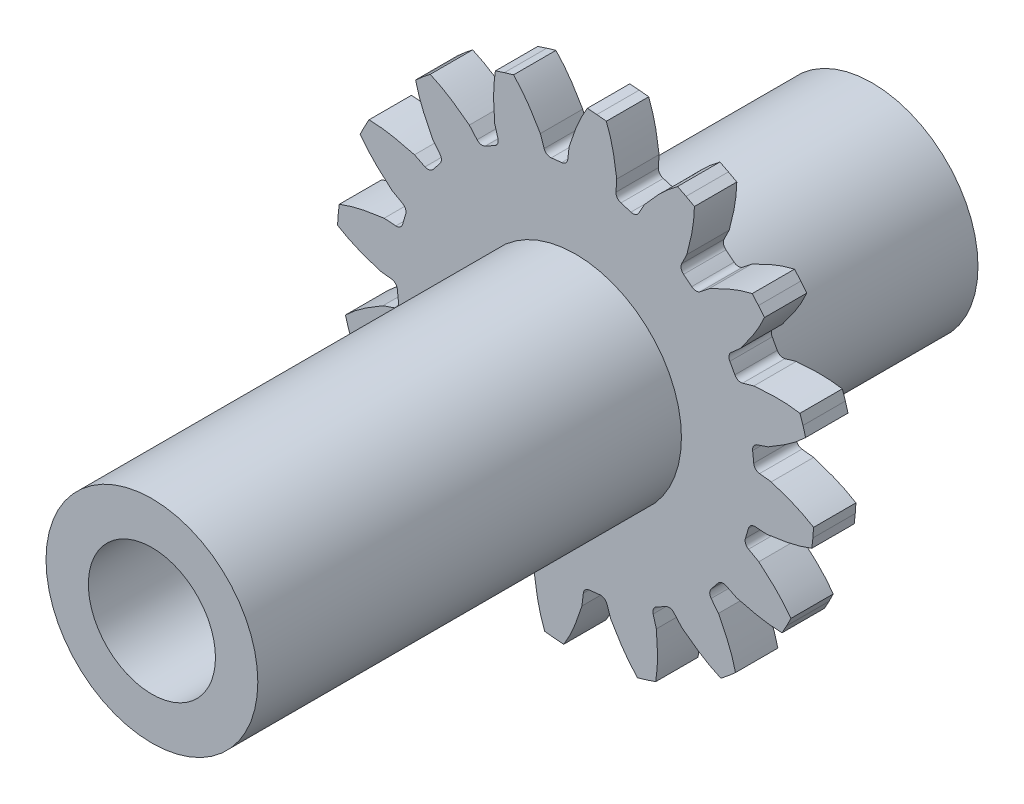
from build123d import *

# Parameters (mm, degrees)
BOSS_EXTRUDE1_DEPTH = 10
FILLET1_R           = 0.3125
SCALE1_SCALE_X      = 10
SCALE1_SCALE_Y      = 10
SCALE1_SCALE_Z      = 1
SKETCH5_R           = 50
BOSS_EXTRUDE2_DEPTH = 200
SKETCH15_R          = 30
CUT_EXTRUDE1_DEPTH  = 200
BOSS_EXTRUDE3_START = 120
SKETCH16_R          = 50
BOSS_EXTRUDE3_DEPTH = 120


with BuildPart() as part:
    # Sketch2 → Boss-Extrude1 (new, symmetric)
    with BuildSketch(Plane.XY):
        with BuildLine():
            Line((-0.302623993, 9.238795325), (-0.396248786, 8.428190384))
            add(Edge.make_bspline(
                [(-1.398467591, 8.32079892), (-0.900663309, 8.404442545), (-0.396248786, 8.428190384)],
                knots=[0, 0, 0, 1, 1, 1], degree=2))
            Line((-1.398467591, 8.32079892), (-1.661713487, 9.093163842))
            add(Edge.make_bspline(
                [(-1.661713487, 9.093163842), (-2.020761764, 9.720213192), (-2.416112385, 10.344214849), (-2.925379163, 10.862994833)],
                knots=[0, 0, 0, 0, 1, 1, 1, 1], degree=3))
            Line((-2.925379163, 10.862994833), (-3.357860116, 10.737191227))
            Line((-3.357860116, 10.737191227), (-3.784958773, 10.594177037))
            add(Edge.make_bspline(
                [(-3.815122027, 8.419724719), (-3.877304002, 9.139613568), (-3.907915489, 9.87768072), (-3.784958773, 10.594177037)],
                knots=[0, 0, 0, 0, 1, 1, 1, 1], degree=3))
            Line((-3.815122027, 8.419724719), (-3.591414982, 7.634994744))
            add(Edge.make_bspline(
                [(-4.476247489, 7.152245434), (-4.048255538, 7.420072844), (-3.591414982, 7.634994744)],
                knots=[0, 0, 0, 1, 1, 1], degree=2))
            Line((-4.476247489, 7.152245434), (-5.015026238, 7.765077737))
            add(Edge.make_bspline(
                [(-5.015026238, 7.765077737), (-5.586438573, 8.207436933), (-6.190778664, 8.632151208), (-6.859786092, 8.916604442)],
                knots=[0, 0, 0, 0, 1, 1, 1, 1], degree=3))
            Line((-6.859786092, 8.916604442), (-7.211203432, 8.634873772))
            Line((-7.211203432, 8.634873772), (-7.551061976, 8.339302311))
            add(Edge.make_bspline(
                [(-6.746802312, 6.318827346), (-7.080223864, 6.959938712), (-7.390413769, 7.630305318), (-7.551061976, 8.339302311)],
                knots=[0, 0, 0, 0, 1, 1, 1, 1], degree=3))
            Line((-6.746802312, 6.318827346), (-6.239820787, 5.67944037))
            add(Edge.make_bspline(
                [(-6.872559268, 4.894827424), (-6.579703447, 5.305973173), (-6.239820787, 5.67944037)],
                knots=[0, 0, 0, 1, 1, 1], degree=2))
            Line((-6.872559268, 4.894827424), (-7.6048467, 5.25482894))
            add(Edge.make_bspline(
                [(-7.6048467, 5.25482894), (-8.302123015, 5.444334318), (-9.022913921, 5.606015014), (-9.749852755, 5.612741867)],
                knots=[0, 0, 0, 0, 1, 1, 1, 1], degree=3))
            Line((-9.749852755, 5.612741867), (-9.966706385, 5.217975069))
            Line((-9.966706385, 5.217975069), (-10.167584439, 4.814844409))
            add(Edge.make_bspline(
                [(-8.65134311, 3.255945788), (-9.204350686, 3.721014784), (-9.747888564, 4.221261479), (-10.167584439, 4.814844409)],
                knots=[0, 0, 0, 0, 1, 1, 1, 1], degree=3))
            Line((-8.65134311, 3.255945788), (-7.938270456, 2.85924267))
            add(Edge.make_bspline(
                [(-8.222586211, 1.892216293), (-8.10933276, 2.384234876), (-7.938270456, 2.85924267)],
                knots=[0, 0, 0, 1, 1, 1], degree=2))
            Line((-8.222586211, 1.892216293), (-9.036898195, 1.944580063))
            add(Edge.make_bspline(
                [(-9.036898195, 1.944580063), (-9.753742916, 1.853325712), (-10.481394233, 1.72631108), (-11.155592729, 1.454390203)],
                knots=[0, 0, 0, 0, 1, 1, 1, 1], degree=3))
            Line((-11.155592729, 1.454390203), (-11.204868646, 1.006686951))
            Line((-11.204868646, 1.006686951), (-11.236184343, 0.557370086))
            add(Edge.make_bspline(
                [(-9.238795342, -0.302624001), (-9.927894173, -0.085054444), (-10.621252328, 0.169628943), (-11.236184343, 0.557370086)],
                knots=[0, 0, 0, 0, 1, 1, 1, 1], degree=3))
            Line((-9.238795342, -0.302624001), (-8.428190401, -0.396248794))
            add(Edge.make_bspline(
                [(-8.320798937, -1.398467598), (-8.404442527, -0.900663312), (-8.428190401, -0.396248794)],
                knots=[0, 0, 0, 1, 1, 1], degree=2))
            Line((-8.320798937, -1.398467598), (-9.093163859, -1.661713495))
            add(Edge.make_bspline(
                [(-9.093163859, -1.661713495), (-9.720213202, -2.020761772), (-10.344214854, -2.416112389), (-10.862994833, -2.925379163)],
                knots=[0, 0, 0, 0, 1, 1, 1, 1], degree=3))
            Line((-10.862994833, -2.925379163), (-10.737191227, -3.357860116))
            Line((-10.737191227, -3.357860116), (-10.594177037, -3.784958773))
            add(Edge.make_bspline(
                [(-8.419724736, -3.815122035), (-9.13961358, -3.877304001), (-9.877680726, -3.907915488), (-10.594177037, -3.784958773)],
                knots=[0, 0, 0, 0, 1, 1, 1, 1], degree=3))
            Line((-8.419724736, -3.815122035), (-7.634994761, -3.59141499))
            add(Edge.make_bspline(
                [(-7.152245451, -4.476247497), (-7.420072829, -4.048255528), (-7.634994761, -3.59141499)],
                knots=[0, 0, 0, 1, 1, 1], degree=2))
            Line((-7.152245451, -4.476247497), (-7.765077754, -5.015026246))
            add(Edge.make_bspline(
                [(-7.765077754, -5.015026246), (-8.207436937, -5.586438584), (-8.63215121, -6.190778669), (-8.916604442, -6.859786092)],
                knots=[0, 0, 0, 0, 1, 1, 1, 1], degree=3))
            Line((-8.916604442, -6.859786092), (-8.634873772, -7.211203432))
            Line((-8.634873772, -7.211203432), (-8.339302311, -7.551061976))
            add(Edge.make_bspline(
                [(-6.318827363, -6.74680232), (-6.959938724, -7.08022387), (-7.630305324, -7.39041377), (-8.339302311, -7.551061976)],
                knots=[0, 0, 0, 0, 1, 1, 1, 1], degree=3))
            Line((-6.318827363, -6.74680232), (-5.679440387, -6.239820795))
            add(Edge.make_bspline(
                [(-4.894827441, -6.872559276), (-5.305973169, -6.579703429), (-5.679440387, -6.239820795)],
                knots=[0, 0, 0, 1, 1, 1], degree=2))
            Line((-4.894827441, -6.872559276), (-5.254828957, -7.604846708))
            add(Edge.make_bspline(
                [(-5.254828957, -7.604846708), (-5.444334315, -8.302123024), (-5.606015015, -9.022913925), (-5.612741867, -9.749852755)],
                knots=[0, 0, 0, 0, 1, 1, 1, 1], degree=3))
            Line((-5.612741867, -9.749852755), (-5.217975069, -9.966706385))
            Line((-5.217975069, -9.966706385), (-4.814844409, -10.167584439))
            add(Edge.make_bspline(
                [(-3.255945805, -8.651343118), (-3.72101479, -9.204350696), (-4.221261484, -9.747888567), (-4.814844409, -10.167584439)],
                knots=[0, 0, 0, 0, 1, 1, 1, 1], degree=3))
            Line((-3.255945805, -8.651343118), (-2.859242687, -7.938270464))
            add(Edge.make_bspline(
                [(-1.89221631, -8.222586219), (-2.384234886, -8.109332744), (-2.859242687, -7.938270464)],
                knots=[0, 0, 0, 1, 1, 1], degree=2))
            Line((-1.89221631, -8.222586219), (-1.94458008, -9.036898203))
            add(Edge.make_bspline(
                [(-1.94458008, -9.036898203), (-1.853325706, -9.753742918), (-1.72631108, -10.481394234), (-1.454390203, -11.155592729)],
                knots=[0, 0, 0, 0, 1, 1, 1, 1], degree=3))
            Line((-1.454390203, -11.155592729), (-1.006686951, -11.204868646))
            Line((-1.006686951, -11.204868646), (-0.557370086, -11.236184343))
            add(Edge.make_bspline(
                [(0.302623984, -9.23879535), (0.085054445, -9.927894182), (-0.169628946, -10.621252331), (-0.557370086, -11.236184343)],
                knots=[0, 0, 0, 0, 1, 1, 1, 1], degree=3))
            Line((0.302623984, -9.23879535), (0.396248777, -8.428190409))
            add(Edge.make_bspline(
                [(1.398467582, -8.320798945), (0.900663294, -8.404442523), (0.396248777, -8.428190409)],
                knots=[0, 0, 0, 1, 1, 1], degree=2))
            Line((1.398467582, -8.320798945), (1.661713478, -9.093163867))
            add(Edge.make_bspline(
                [(1.661713478, -9.093163867), (2.020761776, -9.720213198), (2.416112388, -10.344214853), (2.925379163, -10.862994833)],
                knots=[0, 0, 0, 0, 1, 1, 1, 1], degree=3))
            Line((2.925379163, -10.862994833), (3.357860116, -10.737191227))
            Line((3.357860116, -10.737191227), (3.784958773, -10.594177037))
            add(Edge.make_bspline(
                [(3.815122018, -8.419724743), (3.877304006, -9.139613584), (3.907915487, -9.877680728), (3.784958773, -10.594177037)],
                knots=[0, 0, 0, 0, 1, 1, 1, 1], degree=3))
            Line((3.815122018, -8.419724743), (3.591414973, -7.634994769))
            add(Edge.make_bspline(
                [(4.47624748, -7.152245459), (4.048255513, -7.420072838), (3.591414973, -7.634994769)],
                knots=[0, 0, 0, 1, 1, 1], degree=2))
            Line((4.47624748, -7.152245459), (5.015026229, -7.765077762))
            add(Edge.make_bspline(
                [(5.015026229, -7.765077762), (5.586438582, -8.207436929), (6.190778666, -8.63215121), (6.859786092, -8.916604442)],
                knots=[0, 0, 0, 0, 1, 1, 1, 1], degree=3))
            Line((6.859786092, -8.916604442), (7.211203432, -8.634873772))
            Line((7.211203432, -8.634873772), (7.551061976, -8.339302311))
            add(Edge.make_bspline(
                [(6.746802303, -6.318827371), (7.080223876, -6.959938721), (7.39041377, -7.630305325), (7.551061976, -8.339302311)],
                knots=[0, 0, 0, 0, 1, 1, 1, 1], degree=3))
            Line((6.746802303, -6.318827371), (6.239820778, -5.679440395))
            add(Edge.make_bspline(
                [(6.872559259, -4.894827449), (6.579703425, -5.305973187), (6.239820778, -5.679440395)],
                knots=[0, 0, 0, 1, 1, 1], degree=2))
            Line((6.872559259, -4.894827449), (7.604846691, -5.254828965))
            add(Edge.make_bspline(
                [(7.604846691, -5.254828965), (8.302123015, -5.444334309), (9.02291392, -5.606015015), (9.749852755, -5.612741867)],
                knots=[0, 0, 0, 0, 1, 1, 1, 1], degree=3))
            Line((9.749852755, -5.612741867), (9.966706385, -5.217975069))
            Line((9.966706385, -5.217975069), (10.167584439, -4.814844409))
            add(Edge.make_bspline(
                [(8.651343102, -3.255945813), (9.204350697, -3.721014782), (9.747888565, -4.221261482), (10.167584439, -4.814844409)],
                knots=[0, 0, 0, 0, 1, 1, 1, 1], degree=3))
            Line((8.651343102, -3.255945813), (7.938270447, -2.859242695))
            add(Edge.make_bspline(
                [(8.222586202, -1.892216318), (8.109332754, -2.384234902), (7.938270447, -2.859242695)],
                knots=[0, 0, 0, 1, 1, 1], degree=2))
            Line((8.222586202, -1.892216318), (9.036898186, -1.944580088))
            add(Edge.make_bspline(
                [(9.036898186, -1.944580088), (9.753742906, -1.853325706), (10.481394229, -1.726311082), (11.155592729, -1.454390203)],
                knots=[0, 0, 0, 0, 1, 1, 1, 1], degree=3))
            Line((11.155592729, -1.454390203), (11.204868646, -1.006686951))
            Line((11.204868646, -1.006686951), (11.236184343, -0.557370086))
            add(Edge.make_bspline(
                [(9.238795333, 0.302623976), (9.927894175, 0.085054452), (10.621252327, -0.169628944), (11.236184343, -0.557370086)],
                knots=[0, 0, 0, 0, 1, 1, 1, 1], degree=3))
            Line((9.238795333, 0.302623976), (8.428190392, 0.396248769))
            add(Edge.make_bspline(
                [(8.320798928, 1.398467574), (8.404442541, 0.90066329), (8.428190392, 0.396248769)],
                knots=[0, 0, 0, 1, 1, 1], degree=2))
            Line((8.320798928, 1.398467574), (9.09316385, 1.66171347))
            add(Edge.make_bspline(
                [(9.09316385, 1.66171347), (9.720213187, 2.020761769), (10.344214849, 2.416112384), (10.862994833, 2.925379163)],
                knots=[0, 0, 0, 0, 1, 1, 1, 1], degree=3))
            Line((10.862994833, 2.925379163), (10.737191227, 3.357860116))
            Line((10.737191227, 3.357860116), (10.594177037, 3.784958773))
            add(Edge.make_bspline(
                [(8.419724727, 3.81512201), (9.139613573, 3.877304008), (9.877680722, 3.907915488), (10.594177037, 3.784958773)],
                knots=[0, 0, 0, 0, 1, 1, 1, 1], degree=3))
            Line((8.419724727, 3.81512201), (7.634994752, 3.591414965))
            add(Edge.make_bspline(
                [(7.152245442, 4.476247472), (7.420072854, 4.048255523), (7.634994752, 3.591414965)],
                knots=[0, 0, 0, 1, 1, 1], degree=2))
            Line((7.152245442, 4.476247472), (7.765077745, 5.015026221))
            add(Edge.make_bspline(
                [(7.765077745, 5.015026221), (8.207436925, 5.586438571), (8.632151207, 6.190778661), (8.916604442, 6.859786092)],
                knots=[0, 0, 0, 0, 1, 1, 1, 1], degree=3))
            Line((8.916604442, 6.859786092), (8.634873772, 7.211203432))
            Line((8.634873772, 7.211203432), (8.339302311, 7.551061976))
            add(Edge.make_bspline(
                [(6.318827354, 6.746802295), (6.95993871, 7.08022387), (7.630305319, 7.390413768), (8.339302311, 7.551061976)],
                knots=[0, 0, 0, 0, 1, 1, 1, 1], degree=3))
            Line((6.318827354, 6.746802295), (5.679440378, 6.23982077))
            add(Edge.make_bspline(
                [(4.894827432, 6.872559251), (5.305973191, 6.579703443), (5.679440378, 6.23982077)],
                knots=[0, 0, 0, 1, 1, 1], degree=2))
            Line((4.894827432, 6.872559251), (5.254828948, 7.604846683))
            add(Edge.make_bspline(
                [(5.254828948, 7.604846683), (5.444334312, 8.302123007), (5.606015014, 9.022913916), (5.612741867, 9.749852755)],
                knots=[0, 0, 0, 0, 1, 1, 1, 1], degree=3))
            Line((5.612741867, 9.749852755), (5.217975069, 9.966706385))
            Line((5.217975069, 9.966706385), (4.814844409, 10.167584439))
            add(Edge.make_bspline(
                [(3.255945796, 8.651343094), (3.721014776, 9.204350686), (4.221261477, 9.747888562), (4.814844409, 10.167584439)],
                knots=[0, 0, 0, 0, 1, 1, 1, 1], degree=3))
            Line((3.255945796, 8.651343094), (2.859242678, 7.938270439))
            add(Edge.make_bspline(
                [(1.892216301, 8.222586194), (2.384234892, 8.10933277), (2.859242678, 7.938270439)],
                knots=[0, 0, 0, 1, 1, 1], degree=2))
            Line((1.892216301, 8.222586194), (1.944580071, 9.036898178))
            add(Edge.make_bspline(
                [(1.944580071, 9.036898178), (1.853325712, 9.753742904), (1.726311082, 10.481394227), (1.454390203, 11.155592729)],
                knots=[0, 0, 0, 0, 1, 1, 1, 1], degree=3))
            Line((1.454390203, 11.155592729), (1.006686951, 11.204868646))
            Line((1.006686951, 11.204868646), (0.557370086, 11.236184343))
            add(Edge.make_bspline(
                [(-0.302623993, 9.238795325), (-0.08505445, 9.927894166), (0.169628941, 10.621252324), (0.557370086, 11.236184343)],
                knots=[0, 0, 0, 0, 1, 1, 1, 1], degree=3))
        make_face()
    extrude(amount=BOSS_EXTRUDE1_DEPTH, both=True)

    # Fillet1
    fillet1_edges = [part.edges().sort_by_distance(p)[0] for p in [
        (-0.396248786, 8.428190384, -5),
        (-1.398467591, 8.32079892, -5),
        (-3.591414982, 7.634994744, 5),
        (-4.476247489, 7.152245434, -5),
        (-6.239820787, 5.67944037, 5),
        (-6.872559268, 4.894827424, -5),
        (-7.938270456, 2.85924267, 5),
        (-8.222586211, 1.892216293, -5),
        (-8.428190401, -0.396248794, 5),
        (-8.320798937, -1.398467598, -5),
        (-7.634994761, -3.59141499, 5),
        (-7.152245451, -4.476247497, -5),
        (-5.679440387, -6.239820795, 5),
        (-4.894827441, -6.872559276, -5),
        (-2.859242687, -7.938270464, 5),
        (-1.89221631, -8.222586219, -5),
        (0.396248777, -8.428190409, 5),
        (1.398467582, -8.320798945, -5),
        (3.591414973, -7.634994769, 5),
        (4.47624748, -7.152245459, -5),
        (6.239820778, -5.679440395, 5),
        (6.872559259, -4.894827449, -5),
        (7.938270447, -2.859242695, 5),
        (8.222586202, -1.892216318, -5),
        (8.428190392, 0.396248769, 5),
        (8.320798928, 1.398467574, -5),
        (7.634994752, 3.591414965, 5),
        (7.152245442, 4.476247472, -5),
        (4.894827432, 6.872559251, -5),
        (5.679440378, 6.23982077, 5),
        (1.892216301, 8.222586194, -5),
        (2.859242678, 7.938270439, 5),
    ]]
    fillet(fillet1_edges, radius=FILLET1_R)


with BuildPart() as part_1:
    # Scale1: scaled about (0, 0, 0)
    add(part.part.scale((SCALE1_SCALE_X, SCALE1_SCALE_Y, SCALE1_SCALE_Z), about=(0, 0, 0)))

    # Sketch5 → Boss-Extrude2 (add)
    with BuildSketch(Plane.XY.offset(10)):
        Circle(SKETCH5_R)
    extrude(amount=BOSS_EXTRUDE2_DEPTH)

    # Sketch15 → Cut-Extrude1 (cut)
    with BuildSketch(Plane.XY.offset(210)):
        Circle(SKETCH15_R)
    extrude(amount=-CUT_EXTRUDE1_DEPTH, mode=Mode.SUBTRACT)

    # Sketch16 → Boss-Extrude3 (add)
    with BuildSketch(Plane(origin=(0, 0, -10), x_dir=(-1, 0, 0), z_dir=(0, 0, -1)).offset(BOSS_EXTRUDE3_START)):
        Circle(SKETCH16_R)
    extrude(amount=-BOSS_EXTRUDE3_DEPTH)


solid = part_1.part
